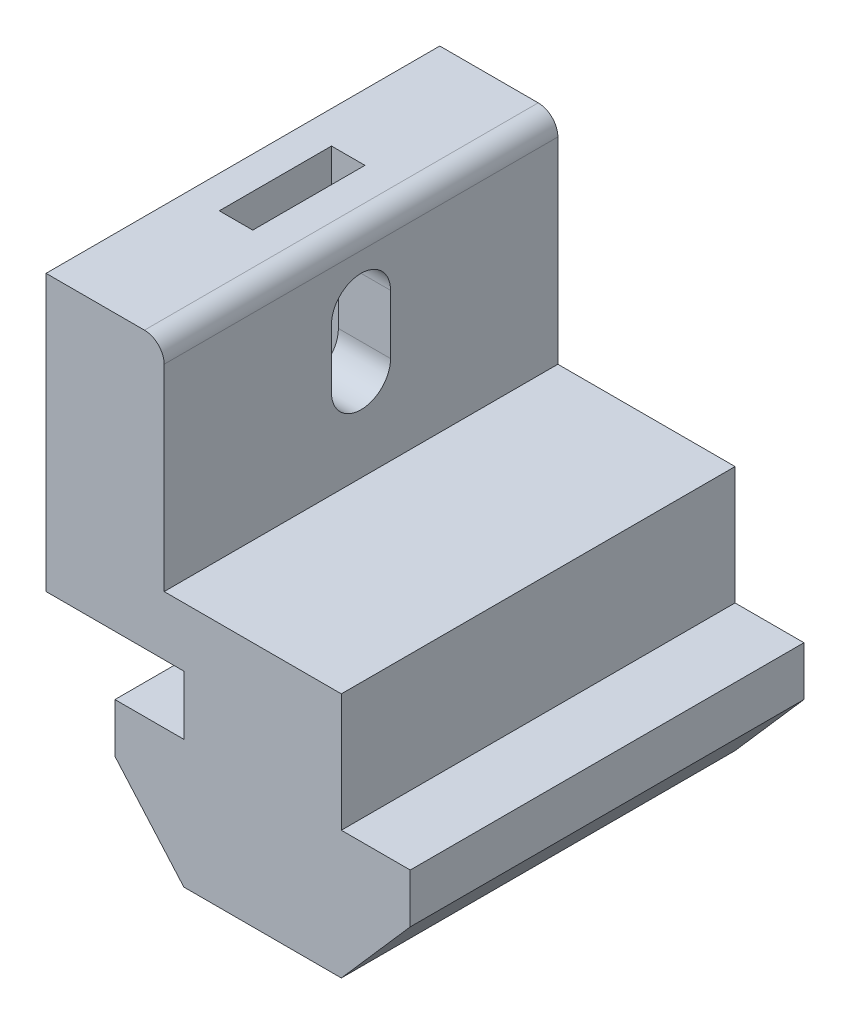
from build123d import *

# Parameters (mm, degrees)
ESTRUSIONE_ESTRUSIONE1_DEPTH = 20
TAGLIO_ESTRUSIONE1_REACH     = 37.979
ESTRUSIONE_ESTRUSIONE4_DEPTH = 0.6
SCHIZZO12_W                  = 1.7
SCHIZZO12_H                  = 5.7
TAGLIO_ESTRUSIONE2_DEPTH     = 11


with BuildPart() as part:
    # Schizzo2 → Estrusione-Estrusione1 (new body)
    with BuildSketch(Plane.XY):
        with BuildLine():
            Line((-4, 9.5), (-11, 9.5))
            Line((-11, 9.5), (-11, 23.5))
            Line((-11, 23.5), (-6, 23.5))
            ThreePointArc((-6, 23.5), (-5.292893219, 23.207106781), (-5, 22.5))
            Line((-5, 22.5), (-5, 12.5))
            Line((-5, 12.5), (4, 12.5))
            Line((4, 12.5), (4, 9.5))
            Line((4, 9.5), (4, 6.5))
            Line((4, 6.5), (7.5, 6.5))
            Line((7.5, 6.5), (7.5, 4))
            Line((7.5, 4), (4, 0))
            Line((4, 0), (-4, 0))
            Line((-4, 0), (-7.5, 4))
            Line((-7.5, 4), (-7.5, 6.5))
            Line((-7.5, 6.5), (-4, 6.5))
            Line((-4, 6.5), (-4, 9.5))
        make_face()
    extrude(amount=-ESTRUSIONE_ESTRUSIONE1_DEPTH)

    # Schizzo6 → Taglio-Estrusione1 (cut, up to next)
    with BuildSketch(Plane.ZY.offset(11), mode=Mode.PRIVATE) as taglio_estrusione1_sk1:
        with BuildLine():
            Line((-8.5, 20), (-8.5, 17))
            ThreePointArc((-8.5, 17), (-10, 15.5), (-11.5, 17))
            Line((-11.5, 17), (-11.5, 20))
            ThreePointArc((-11.5, 20), (-10, 21.5), (-8.5, 20))
        make_face()
    taglio_estrusione1_tool1 = extrude(taglio_estrusione1_sk1.sketch, amount=-TAGLIO_ESTRUSIONE1_REACH, mode=Mode.PRIVATE) & part.part
    add(taglio_estrusione1_tool1.solids().sort_by_distance((-11, 18.5, -10))[0], mode=Mode.SUBTRACT)

    # Schizzo11 → Estrusione-Estrusione4 (add)
    with BuildSketch(Plane(origin=(0, 0, -20), x_dir=(-1, 0, 0), z_dir=(0, 0, -1))):
        with BuildLine():
            Line((-1.916666667, 6), (-2.5, 6))
            add(Edge.make_bspline(
                [(-2.5, 6), (-2.484196549, 6.065431756), (-2.453302094, 6.193345487), (-2.388863743, 6.376101829), (-2.318665127, 6.549045511), (-2.234371075, 6.708938219), (-2.142426246, 6.858993324), (-2.037084049, 6.995807413), (-1.923204564, 7.122860063), (-1.797243944, 7.235613218), (-1.665147858, 7.337714716), (-1.525054993, 7.424768393), (-1.379783905, 7.499656106), (-1.228328086, 7.561350822), (-1.070236625, 7.607826795), (-0.906938753, 7.641546577), (-0.738006538, 7.66344436), (-0.623332441, 7.665581492), (-0.565104167, 7.666666667)],
                knots=[0, 0, 0, 0, 1.162005537, 2.271625781, 3.343758855, 4.383309926, 5.390229558, 6.379919256, 7.361854164, 8.333198761, 9.295911338, 10.242430842, 11.177959212, 12.116337295, 13.062827104, 14.020064771, 14.994644689, 16, 16, 16, 16], degree=3))
            add(Edge.make_bspline(
                [(-0.565104167, 7.666666667), (-0.480264789, 7.664105239), (-0.312436625, 7.659038256), (-0.065876681, 7.612768588), (0.171887412, 7.539550485), (0.398253158, 7.438384992), (0.608515961, 7.313608553), (0.795597451, 7.165102613), (0.956961828, 6.995732482), (1.092337101, 6.80865772), (1.198333527, 6.608726059), (1.276493935, 6.402954339), (1.324077057, 6.191830678), (1.330243806, 6.049281445), (1.333333333, 5.977864583)],
                knots=[0, 0, 0, 0, 1.083050992, 2.142477498, 3.193116406, 4.255571735, 5.30263384, 6.308962982, 7.297363603, 8.282367274, 9.249857812, 10.179914175, 11.08814088, 12, 12, 12, 12], degree=3))
            add(Edge.make_bspline(
                [(1.333333333, 5.977864583), (1.331172379, 5.909137679), (1.326943725, 5.774649792), (1.291038272, 5.578309869), (1.230613784, 5.393261183), (1.146912796, 5.218724739), (1.038564203, 5.055807179), (0.907314909, 4.904141953), (0.752238537, 4.763056374), (0.634720509, 4.682234495), (0.57421875, 4.640625)],
                knots=[0, 0, 0, 0, 1.024540389, 2.004866551, 2.965041327, 3.920577974, 4.882998113, 5.874504559, 6.905732034, 8, 8, 8, 8], degree=3))
            add(Edge.make_bspline(
                [(0.57421875, 4.640625), (0.643363437, 4.607236967), (0.780359061, 4.541085617), (0.967095758, 4.411353496), (1.136611813, 4.261563137), (1.231147291, 4.144669639), (1.278645833, 4.0859375)],
                knots=[0, 0, 0, 0, 1.015518401, 2.012035669, 3.001164323, 4, 4, 4, 4], degree=3))
            add(Edge.make_bspline(
                [(1.278645833, 4.0859375), (1.309922612, 4.043115961), (1.37196399, 3.958174116), (1.448544267, 3.821606468), (1.518018337, 3.683525131), (1.572154458, 3.540229091), (1.614077354, 3.393379209), (1.644044271, 3.24272333), (1.662660533, 3.088138431), (1.665326558, 2.983558111), (1.666666667, 2.930989583)],
                knots=[0, 0, 0, 0, 1.025084078, 2.033381695, 3.024893161, 4.013698104, 4.991890475, 5.976764909, 6.982997093, 8, 8, 8, 8], degree=3))
            add(Edge.make_bspline(
                [(1.666666667, 2.930989583), (1.663333999, 2.83997153), (1.656684346, 2.658363755), (1.597248208, 2.390053558), (1.505109333, 2.127777625), (1.374260737, 1.876924352), (1.214792507, 1.64221793), (1.025071762, 1.43221907), (0.807254146, 1.251707377), (0.56432937, 1.100888382), (0.301140417, 0.980326526), (0.019642889, 0.896648418), (-0.276107211, 0.842148704), (-0.478920764, 0.836304519), (-0.58203125, 0.833333333)],
                knots=[0, 0, 0, 0, 0.955779014, 1.907060117, 2.875433937, 3.871313158, 4.872415639, 5.851225146, 6.836215519, 7.83643374, 8.849228613, 9.86973379, 10.916971861, 12, 12, 12, 12], degree=3))
            add(Edge.make_bspline(
                [(-0.58203125, 0.833333333), (-0.651524236, 0.834945729), (-0.78826326, 0.838118387), (-0.9892869, 0.859807218), (-1.181170056, 0.899420085), (-1.364172166, 0.952726223), (-1.538455805, 1.020310887), (-1.703489143, 1.104474184), (-1.860287517, 1.203481259), (-2.007371283, 1.318500779), (-2.144722909, 1.447166124), (-2.268692254, 1.591761428), (-2.381346155, 1.74961375), (-2.479668199, 1.922556569), (-2.568136825, 2.108354904), (-2.640901459, 2.309387829), (-2.704946086, 2.523858156), (-2.73472252, 2.673316816), (-2.75, 2.75)],
                knots=[0, 0, 0, 0, 1.048658725, 2.063410685, 3.046034179, 4.001477787, 4.936774919, 5.862367409, 6.792675028, 7.730719943, 8.675894397, 9.627829632, 10.600096036, 11.597688215, 12.626045268, 13.701542398, 14.82072376, 16, 16, 16, 16], degree=3))
            Line((-2.75, 2.75), (-2.166666667, 2.75))
            add(Edge.make_bspline(
                [(-2.166666667, 2.75), (-2.151469125, 2.699951833), (-2.121908588, 2.602603799), (-2.071590606, 2.462500375), (-2.014263815, 2.33406399), (-1.952765349, 2.216352478), (-1.888176806, 2.108206588), (-1.815906231, 2.012485974), (-1.74130639, 1.924986312), (-1.685073305, 1.875689176), (-1.657552083, 1.8515625)],
                knots=[0, 0, 0, 0, 1.198163088, 2.33053128, 3.407730985, 4.417276592, 5.372219308, 6.28897303, 7.162600585, 8, 8, 8, 8], degree=3))
            add(Edge.make_bspline(
                [(-1.657552083, 1.8515625), (-1.621158441, 1.823504166), (-1.548483496, 1.767474107), (-1.430056781, 1.695971082), (-1.305507707, 1.634014892), (-1.172137598, 1.586688029), (-1.032824452, 1.54661523), (-0.885316488, 1.520391409), (-0.730915085, 1.502399091), (-0.625489239, 1.500811361), (-0.571614583, 1.5)],
                knots=[0, 0, 0, 0, 0.946170439, 1.889420265, 2.845303464, 3.807233317, 4.801018734, 5.828864929, 6.890507805, 8, 8, 8, 8], degree=3))
            add(Edge.make_bspline(
                [(-0.571614583, 1.5), (-0.51078665, 1.501143824), (-0.391842877, 1.503380473), (-0.218283853, 1.523949643), (-0.053170021, 1.553906125), (0.101665412, 1.600173093), (0.24825064, 1.657337532), (0.384530847, 1.729113142), (0.512295044, 1.813324768), (0.629906797, 1.909040348), (0.735662739, 2.013823125), (0.828778978, 2.123418828), (0.907939064, 2.237365369), (0.97179428, 2.356293307), (1.022216731, 2.479710161), (1.056542675, 2.607962273), (1.080409774, 2.740000053), (1.082353483, 2.829753852), (1.083333333, 2.875)],
                knots=[0, 0, 0, 0, 1.217147791, 2.380027433, 3.494444702, 4.572153297, 5.609568379, 6.639424714, 7.649109417, 8.668170816, 9.669597737, 10.625200337, 11.543417969, 12.441394052, 13.322311151, 14.205496177, 15.095365482, 16, 16, 16, 16], degree=3))
            add(Edge.make_bspline(
                [(1.083333333, 2.875), (1.080491345, 2.935563915), (1.074821509, 3.056390388), (1.031534147, 3.234151597), (0.960333399, 3.405423649), (0.860655878, 3.567284402), (0.739318097, 3.71729679), (0.597497555, 3.851143829), (0.43401656, 3.961588284), (0.283551089, 4.037895789), (0.150272941, 4.089964642), (0.036215798, 4.124646719), (-0.091475036, 4.154014937), (-0.231255399, 4.181337727), (-0.384178515, 4.204591659), (-0.5500779, 4.223983603), (-0.728987171, 4.239500107), (-0.852842194, 4.246429284), (-0.916666667, 4.25)],
                knots=[0, 0, 0, 0, 1.07054697, 2.135767047, 3.216561865, 4.33974944, 5.486079747, 6.621378074, 7.775625952, 8.963672916, 9.598146892, 10.304877434, 11.070270905, 11.915000392, 12.823868403, 13.805723172, 14.86925407, 16, 16, 16, 16], degree=3))
            Line((-0.916666667, 4.25), (-0.916666667, 4.916666667))
            add(Edge.make_bspline(
                [(-0.916666667, 4.916666667), (-0.836250216, 4.918031302), (-0.678734144, 4.920704288), (-0.448644721, 4.95303345), (-0.228622855, 4.997754616), (-0.02354462, 5.066255688), (0.163374419, 5.145816239), (0.325539394, 5.238398914), (0.460678382, 5.34131202), (0.568134658, 5.456144008), (0.648974654, 5.579300525), (0.708081563, 5.707660032), (0.742996455, 5.842347574), (0.747657265, 5.934266243), (0.75, 5.98046875)],
                knots=[0, 0, 0, 0, 1.321986639, 2.589447074, 3.816329219, 5.01088745, 6.139805852, 7.153945165, 8.075214402, 8.924034688, 9.728124013, 10.488707548, 11.240355623, 12, 12, 12, 12], degree=3))
            add(Edge.make_bspline(
                [(0.75, 5.98046875), (0.74923038, 6.014413134), (0.747699256, 6.081943876), (0.728390026, 6.180604717), (0.69937395, 6.276249331), (0.659483024, 6.368470979), (0.606089798, 6.456630059), (0.542192966, 6.541478178), (0.466109351, 6.622530911), (0.37892495, 6.698080076), (0.285303026, 6.770080088), (0.182696301, 6.831205413), (0.074198534, 6.883474814), (-0.040310397, 6.926578176), (-0.161202096, 6.959002568), (-0.28790856, 6.982283416), (-0.420671401, 6.996839061), (-0.511247475, 6.99893469), (-0.557291667, 7)],
                knots=[0, 0, 0, 0, 0.884392785, 1.759457502, 2.611959086, 3.489218968, 4.37281399, 5.2945488, 6.255912374, 7.266815255, 8.301784654, 9.332968512, 10.37626691, 11.440494194, 12.520033166, 13.637162961, 14.798855837, 16, 16, 16, 16], degree=3))
            add(Edge.make_bspline(
                [(-0.557291667, 7), (-0.631301907, 6.997416042), (-0.775861121, 6.992368971), (-0.984260252, 6.948163375), (-1.177996158, 6.877632648), (-1.326082253, 6.793442755), (-1.435435605, 6.710334806), (-1.51357849, 6.637753232), (-1.590316581, 6.557092273), (-1.660601409, 6.463383862), (-1.731681652, 6.362974109), (-1.79639298, 6.2507587), (-1.859275266, 6.129664825), (-1.897165715, 6.044058647), (-1.916666667, 6)],
                knots=[0, 0, 0, 0, 1.472543308, 2.876219568, 4.221790263, 5.565193594, 6.249813518, 6.953379497, 7.687249741, 8.463570142, 9.283606569, 10.136032583, 11.040678096, 12, 12, 12, 12], degree=3))
        make_face()
    extrude(amount=ESTRUSIONE_ESTRUSIONE4_DEPTH)

    # Schizzo12 → Taglio-Estrusione2 (cut)
    with BuildSketch(Plane(origin=(0, 23.5, 0), x_dir=(1, 0, 0), z_dir=(0, 1, 0))):
        with Locations((-8.5, 10)):
            Rectangle(SCHIZZO12_W, SCHIZZO12_H)
    extrude(amount=-TAGLIO_ESTRUSIONE2_DEPTH, mode=Mode.SUBTRACT)


solid = part.part
